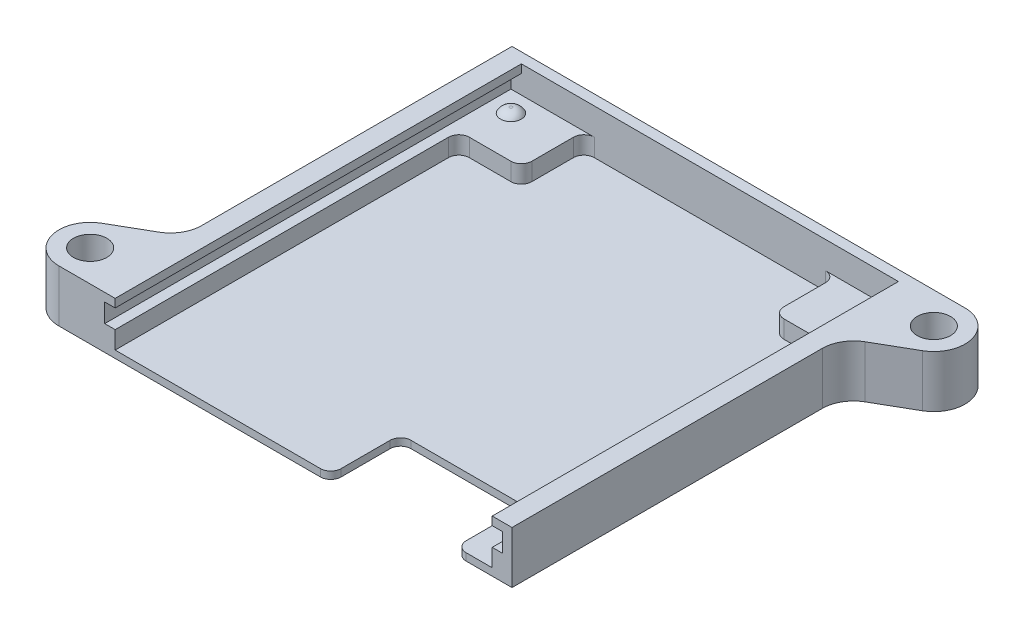
from build123d import *

# Parameters (mm, degrees)
SKETCH1_W           = 40
SKETCH1_H           = 40
BOSS_EXTRUDE1_DEPTH = 5
CUT_EXTRUDE2_DEPTH  = 39
SKETCH4_W           = 12
SKETCH4_H           = 6.7
CUT_EXTRUDE3_DEPTH  = 29.609264234
SKETCH5_W           = 6
SKETCH5_H           = 6
BOSS_EXTRUDE2_DEPTH = 1.7
FILLET1_R           = 1
SKETCH6_R           = 1
BOSS_EXTRUDE3_DEPTH = 0.5
FILLET2_R           = 1
SKETCH7_R           = 1.6
BOSS_EXTRUDE4_DEPTH = 5
FILLET3_R           = 3


with BuildPart() as part:
    # Sketch1 → Boss-Extrude1 (new body)
    with BuildSketch(Plane(origin=(0, 0, 0), x_dir=(1, 0, 0), z_dir=(0, 1, 0))):
        Rectangle(SKETCH1_W, SKETCH1_H)
    extrude(amount=BOSS_EXTRUDE1_DEPTH)

    # Sketch3 → Cut-Extrude2 (cut)
    with BuildSketch(Plane.XY.offset(20)):
        Polygon((-18.1, 5), (-18.1, 4.2), (-19.1, 4.2), (-19.1, 2.4), (-18.1, 2.4), (-18.1, 0.7), (18.1, 0.7), (18.1, 2.4), (19.1, 2.4), (19.1, 4.2), (18.1, 4.2), (18.1, 5), align=None)
    extrude(amount=-CUT_EXTRUDE2_DEPTH, mode=Mode.SUBTRACT)

    # Sketch4 → Cut-Extrude3 (cut, through all)
    with BuildSketch(Plane(origin=(0, 0.7, 0), x_dir=(1, 0, 0), z_dir=(0, 1, 0))):
        with Locations((8.6, -16.65)):
            Rectangle(SKETCH4_W, SKETCH4_H)
    extrude(amount=-CUT_EXTRUDE3_DEPTH, mode=Mode.SUBTRACT)

    # Sketch5 → Boss-Extrude2 (add)
    with BuildSketch(Plane(origin=(0, 0.7, 0), x_dir=(1, 0, 0), z_dir=(0, 1, 0))):
        with Locations((-15.1, 16)):
            Rectangle(SKETCH5_W, SKETCH5_H)
        with Locations((15.1, 16)):
            Rectangle(SKETCH5_W, SKETCH5_H)
    extrude(amount=BOSS_EXTRUDE2_DEPTH)

    # Fillet1
    fillet1_edges = [part.edges().sort_by_distance(p)[0] for p in [
        (2.6, 0.35, 20),
        (2.6, 0.35, 13.3),
        (14.6, 0.35, 13.3),
        (14.6, 0.35, 20),
        (-18.1, 1.55, -13),
        (-12.1, 1.55, -13),
        (-12.1, 1.55, -19),
        (18.1, 1.55, -13),
        (12.1, 1.55, -19),
        (12.1, 1.55, -13),
    ]]
    fillet(fillet1_edges, radius=FILLET1_R)

    # Sketch6 → Boss-Extrude3 (add)
    with BuildSketch(Plane(origin=(0, 2.4, 0), x_dir=(1, 0, 0), z_dir=(0, 1, 0))):
        with Locations((-17.1, 17)):
            Circle(SKETCH6_R)
        with Locations((17.1, 17)):
            Circle(SKETCH6_R)
    extrude(amount=BOSS_EXTRUDE3_DEPTH)

    # Fillet2
    # the kernel refuses this fillet: 1 mm, written as the material it takes off along each edge
    with BuildSketch(Plane(origin=(-17.1, 2.9, -17), x_dir=(1, 0, 0), z_dir=(0, 0, 1))) as fillet2_piece_1:
        with BuildLine():
            CenterArc((0.133974596, -1), FILLET2_R, 30, 60)
            Line((0.133974596, 0), (0.133974596, 0.02))
            Line((0.133974596, 0.02), (1, 0.02))
            Line((1, 0.02), (1.02, 0))
            ThreePointArc((1.02, 0), (1.02, -0.25), (1.017320508, -0.49))
            Line((1.017320508, -0.49), (1, -0.5))
        make_face()
    revolve(axis=Axis((-17.1, 2.9, -17), (0, 1, 0)), mode=Mode.SUBTRACT)
    with BuildSketch(Plane(origin=(17.1, 2.9, -17), x_dir=(1, 0, 0), z_dir=(0, 0, 1))) as fillet2_piece_2:
        with BuildLine():
            CenterArc((0.133974596, -1), FILLET2_R, 30, 60)
            Line((0.133974596, 0), (0.133974596, 0.02))
            Line((0.133974596, 0.02), (1, 0.02))
            Line((1, 0.02), (1.02, 0))
            ThreePointArc((1.02, 0), (1.02, -0.25), (1.017320508, -0.49))
            Line((1.017320508, -0.49), (1, -0.5))
        make_face()
    revolve(axis=Axis((17.1, 2.9, -17), (0, 1, 0)), mode=Mode.SUBTRACT)

    # Sketch7 → Boss-Extrude4 (add)
    # profile 1 of 2: a face of its own
    with BuildSketch(Plane.XZ):
        with BuildLine():
            Line((-20, 20), (-20, 11.521537766))
            Line((-20, 11.521537766), (-24.997516692, 14.400491632))
            ThreePointArc((-24.997516692, 14.400491632), (-26.398148125, 17.775072543), (-23.5, 20))
            Line((-23.5, 20), (-20, 20))
        make_face()
        with Locations(Location((-23.5, 17, 0), (0, 0, 270))):
            Circle(SKETCH7_R, mode=Mode.SUBTRACT)
    # profile 2 of 2: a face of its own
    with BuildSketch(Plane.XZ):
        with BuildLine():
            Line((20, -20), (20, -11.521537766))
            Line((20, -11.521537766), (24.997516692, -14.400491632))
            ThreePointArc((24.997516692, -14.400491632), (26.398148125, -17.775072543), (23.5, -20))
            Line((23.5, -20), (20, -20))
        make_face()
        with Locations(Location((23.5, -17, 0), (0, 0, 270))):
            Circle(SKETCH7_R, mode=Mode.SUBTRACT)
    extrude(amount=-BOSS_EXTRUDE4_DEPTH)

    # Fillet3
    fillet3_edges = [part.edges().sort_by_distance(p)[0] for p in [
        (-20, 2.5, 11.521537766),
        (20, 2.5, -11.521537766),
    ]]
    fillet(fillet3_edges, radius=FILLET3_R)


solid = part.part
